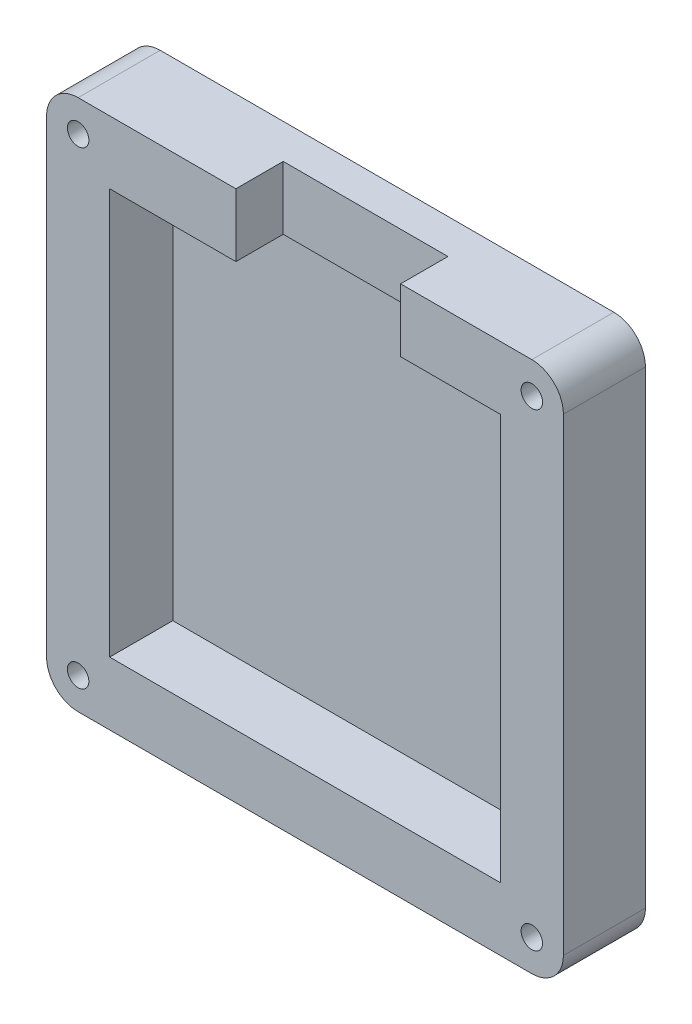
from build123d import *

# Parameters (mm, degrees)
BOSS_EXTRUDE4_START   = 3.1
SKETCH2_R             = 3
SKETCH2_R_2           = 1.7
BOSS_EXTRUDE4_DEPTH   = 9.9
BOSS_EXTRUDE4_2_DEPTH = 9.9
BOSS_EXTRUDE4_3_DEPTH = 9.9
BOSS_EXTRUDE4_4_DEPTH = 9.9
SKETCH2_12_W          = 81.893
SKETCH2_12_H          = 84.275
SKETCH2_12_R          = 3
SKETCH2_12_W_2        = 61.893
SKETCH2_12_H_2        = 64.275
BOSS_EXTRUDE5_DEPTH   = 13
SKETCH2_13_W          = 61.893
SKETCH2_13_H          = 64.275
BOSS_EXTRUDE6_DEPTH   = 3
SKETCH5_W             = 26.09775054
SKETCH5_H             = 10
CUT_EXTRUDE1_DEPTH    = 7.5
FILLET1_R             = 5
SKETCH7_W             = 0.189957265
SKETCH7_H             = 1.546794872
CUT_EXTRUDE2_DEPTH    = 0.2


with BuildPart() as part:
    # Sketch2 → Boss-Extrude4 (new body)
    with BuildSketch(Plane.XY.offset(BOSS_EXTRUDE4_START)):
        with Locations((-35.9465, 37.1375)):
            Circle(SKETCH2_R)
        with Locations((-35.9465, 37.1375)):
            Circle(SKETCH2_R_2, mode=Mode.SUBTRACT)
    extrude(amount=BOSS_EXTRUDE4_DEPTH)



with BuildPart() as body_2:
    # Sketch2 → Boss-Extrude4 2 (new body)
    with BuildSketch(Plane.XY.offset(BOSS_EXTRUDE4_START)):
        with Locations((35.9465, 37.1375)):
            Circle(SKETCH2_R)
        with Locations((35.9465, 37.1375)):
            Circle(SKETCH2_R_2, mode=Mode.SUBTRACT)
    extrude(amount=BOSS_EXTRUDE4_2_DEPTH)


with BuildPart() as body_3:
    # Sketch2 → Boss-Extrude4 3 (new body)
    with BuildSketch(Plane.XY.offset(BOSS_EXTRUDE4_START)):
        with Locations((-35.9465, -37.1375)):
            Circle(SKETCH2_R)
        with Locations((-35.9465, -37.1375)):
            Circle(SKETCH2_R_2, mode=Mode.SUBTRACT)
    extrude(amount=BOSS_EXTRUDE4_3_DEPTH)


with BuildPart() as body_4:
    # Sketch2 → Boss-Extrude4 4 (new body)
    with BuildSketch(Plane.XY.offset(BOSS_EXTRUDE4_START)):
        with Locations((35.9465, -37.1375)):
            Circle(SKETCH2_R)
        with Locations((35.9465, -37.1375)):
            Circle(SKETCH2_R_2, mode=Mode.SUBTRACT)
    extrude(amount=BOSS_EXTRUDE4_4_DEPTH)


with BuildPart() as part_1:
    add(part.part)

    add(body_2.part)  # Boss-Extrude5 merges body 2

    add(body_3.part)  # Boss-Extrude5 merges body 3

    add(body_4.part)  # Boss-Extrude5 merges body 4
    # Sketch2<12> → Boss-Extrude5 (add)
    with BuildSketch(Plane.XY):
        Rectangle(SKETCH2_12_W, SKETCH2_12_H)
        with Locations((-35.9465, -37.1375)):
            Circle(SKETCH2_12_R, mode=Mode.SUBTRACT)
        with Locations((35.9465, -37.1375)):
            Circle(SKETCH2_12_R, mode=Mode.SUBTRACT)
        Rectangle(SKETCH2_12_W_2, SKETCH2_12_H_2, mode=Mode.SUBTRACT)
        with Locations((-35.9465, 37.1375)):
            Circle(SKETCH2_12_R, mode=Mode.SUBTRACT)
        with Locations((35.9465, 37.1375)):
            Circle(SKETCH2_12_R, mode=Mode.SUBTRACT)
    extrude(amount=BOSS_EXTRUDE5_DEPTH)

    # Sketch2<13> → Boss-Extrude6 (add)
    with BuildSketch(Plane.XY):
        Rectangle(SKETCH2_13_W, SKETCH2_13_H)
    extrude(amount=BOSS_EXTRUDE6_DEPTH)

    # Sketch5 → Cut-Extrude1 (cut)
    with BuildSketch(Plane.XY.offset(13)):
        with Locations((2.10237527, 37.1375)):
            Rectangle(SKETCH5_W, SKETCH5_H)
    extrude(amount=-CUT_EXTRUDE1_DEPTH, mode=Mode.SUBTRACT)

    # Fillet1
    fillet1_edges = [part_1.edges().sort_by_distance(p)[0] for p in [
        (-40.9465, -42.1375, 6.5),
        (-40.9465, 42.1375, 6.5),
        (40.9465, -42.1375, 6.5),
        (40.9465, 42.1375, 6.5),
    ]]
    fillet(fillet1_edges, radius=FILLET1_R)

    # Sketch7 → Cut-Extrude2 (cut)
    # profile 1 of 15: a face of its own
    with BuildSketch(Plane(origin=(0, 0, 0), x_dir=(-1, 0, 0), z_dir=(0, 0, -1))):
        with BuildLine():
            Line((0.197612891, 2.170940171), (0.197612891, 0))
            Line((0.197612891, 0), (0.007655626, 0))
            Line((0.007655626, 0), (0.007655626, 0.267551416))
            add(Edge.make_bspline(
                [(0.007655626, 0.267551416), (-0.013764309, 0.243336994), (-0.055565582, 0.196082247), (-0.125379973, 0.134346838), (-0.199383585, 0.083318044), (-0.277217241, 0.042103571), (-0.358810655, 0.011144565), (-0.443982955, -0.010860398), (-0.532768886, -0.025008098), (-0.593397691, -0.026420835), (-0.624121885, -0.027136752)],
                knots=[0, 0, 0, 0, 1.074387032, 2.096679803, 3.090159297, 4.057316773, 5.018401886, 5.985159533, 6.978961417, 8, 8, 8, 8], degree=3))
            add(Edge.make_bspline(
                [(-0.624121885, -0.027136752), (-0.651437743, -0.026395089), (-0.705305824, -0.024932496), (-0.784547218, -0.01358577), (-0.860803007, 0.004636082), (-0.934145248, 0.029976144), (-1.004099355, 0.063589308), (-1.071264271, 0.10383092), (-1.135292042, 0.151752755), (-1.195206734, 0.206536944), (-1.250380373, 0.266042483), (-1.298798381, 0.329509552), (-1.3391681, 0.396663707), (-1.372925959, 0.46665471), (-1.39892851, 0.540021352), (-1.417055422, 0.616509925), (-1.42838893, 0.696029991), (-1.429850918, 0.750180084), (-1.430592237, 0.777637553)],
                knots=[0, 0, 0, 0, 1.033919861, 2.038935746, 3.024066025, 3.998881131, 4.97069526, 5.957263378, 6.95902576, 7.993208707, 9.027059324, 10.027763471, 11.009749337, 11.988697705, 12.965288445, 13.950418724, 14.960734635, 16, 16, 16, 16], degree=3))
            add(Edge.make_bspline(
                [(-1.430592237, 0.777637553), (-1.429834488, 0.804527507), (-1.428336458, 0.857687496), (-1.417176654, 0.935870328), (-1.398410282, 1.011174228), (-1.372074203, 1.083356761), (-1.338303116, 1.152505267), (-1.297222796, 1.218668654), (-1.248830278, 1.282029194), (-1.193039537, 1.341097031), (-1.132602795, 1.395659022), (-1.067948467, 1.443077825), (-1.000684864, 1.484030396), (-0.929768662, 1.516477974), (-0.856249508, 1.542730147), (-0.7794729, 1.560892942), (-0.699758279, 1.571595608), (-0.645637839, 1.57314547), (-0.61818572, 1.573931624)],
                knots=[0, 0, 0, 0, 1.020392517, 2.01726096, 2.990465484, 3.961182959, 4.928053699, 5.906110375, 6.912531644, 7.948652711, 8.985773172, 9.998621852, 10.987621588, 11.969261332, 12.953316658, 13.946091881, 14.958173133, 16, 16, 16, 16], degree=3))
            add(Edge.make_bspline(
                [(-0.61818572, 1.573931624), (-0.586606984, 1.572983904), (-0.524621435, 1.571123635), (-0.433968519, 1.555577403), (-0.348220774, 1.529474139), (-0.266884538, 1.493737983), (-0.190444714, 1.447291815), (-0.118340984, 1.391199273), (-0.05182726, 1.323872856), (-0.0124743, 1.273307761), (0.007655626, 1.247442575)],
                knots=[0, 0, 0, 0, 1.031072012, 2.023879775, 2.993683497, 3.952812103, 4.918022106, 5.908088563, 6.929940113, 8, 8, 8, 8], degree=3))
            Line((0.007655626, 1.247442575), (0.007655626, 2.170940171))
            Line((0.007655626, 2.170940171), (0.197612891, 2.170940171))
        make_face()
        with BuildLine():
            add(Edge.make_bspline(
                [(-0.61564165, 1.383974359), (-0.643408892, 1.382986397), (-0.698217012, 1.381036318), (-0.778676956, 1.365812347), (-0.855671259, 1.34048214), (-0.928814837, 1.305840228), (-0.996952283, 1.262279992), (-1.057847979, 1.209592298), (-1.111999993, 1.149214675), (-1.157543563, 1.08141959), (-1.194670197, 1.008740458), (-1.220775973, 0.932767584), (-1.237993089, 0.85487124), (-1.239752052, 0.802037616), (-1.240634972, 0.775517495)],
                knots=[0, 0, 0, 0, 1.031046209, 2.035121221, 3.029706178, 4.034933723, 5.034054252, 6.02443088, 7.017295772, 8.038157696, 9.050218397, 10.03989886, 11.016116709, 12, 12, 12, 12], degree=3))
            add(Edge.make_bspline(
                [(-1.240634972, 0.775517495), (-1.239507156, 0.749155858), (-1.237255944, 0.696535915), (-1.221078143, 0.618533375), (-1.193936505, 0.542542598), (-1.156899639, 0.469208568), (-1.110522489, 0.401121993), (-1.056766018, 0.339593443), (-0.995110372, 0.286683073), (-0.926816118, 0.242391778), (-0.853877012, 0.206612539), (-0.777172682, 0.181717129), (-0.698145034, 0.1656439), (-0.644410528, 0.16376643), (-0.617337697, 0.162820513)],
                knots=[0, 0, 0, 0, 0.979072187, 1.954306742, 2.945804271, 3.96968567, 4.997920485, 5.998718438, 6.996577872, 8.005894225, 9.015743152, 10.005417472, 10.995077863, 12, 12, 12, 12], degree=3))
            add(Edge.make_bspline(
                [(-0.617337697, 0.162820513), (-0.589853383, 0.163824396), (-0.535189809, 0.165821019), (-0.454491162, 0.181110166), (-0.376177542, 0.206370344), (-0.301315742, 0.24138553), (-0.231576939, 0.284781645), (-0.168985365, 0.335585933), (-0.116059041, 0.394673097), (-0.071190178, 0.459610285), (-0.036007902, 0.530798017), (-0.010380475, 0.60659536), (0.004771172, 0.687004956), (0.006680847, 0.741955997), (0.007655626, 0.770005342)],
                knots=[0, 0, 0, 0, 1.01762866, 2.023962475, 3.030623092, 4.058876274, 5.077231937, 6.066672613, 7.034107872, 8.005628644, 8.981990164, 9.965428785, 10.961468474, 12, 12, 12, 12], degree=3))
            add(Edge.make_bspline(
                [(0.007655626, 0.770005342), (0.007075262, 0.791376316), (0.005932923, 0.833441155), (-0.002794136, 0.895203987), (-0.016676401, 0.954309621), (-0.036238132, 1.0108202), (-0.061935242, 1.064423281), (-0.092927939, 1.115503745), (-0.129761234, 1.163795925), (-0.171842198, 1.20863483), (-0.217904011, 1.249532738), (-0.266644519, 1.286038731), (-0.31864119, 1.316028132), (-0.373019588, 1.34084833), (-0.429874062, 1.360599339), (-0.489667247, 1.373775706), (-0.551763586, 1.382823139), (-0.594124772, 1.383586579), (-0.61564165, 1.383974359)],
                knots=[0, 0, 0, 0, 1.050140795, 2.067009409, 3.05949893, 4.030605086, 5.00011959, 5.97591094, 6.962425594, 7.979863591, 8.993523472, 9.986985069, 10.967611495, 11.937549037, 12.921786183, 13.919465291, 14.943216303, 16, 16, 16, 16], degree=3))
        make_face(mode=Mode.SUBTRACT)
    # profile 2 of 15: a face of its own
    with BuildSketch(Plane(origin=(0, 0, 0), x_dir=(-1, 0, 0), z_dir=(0, 0, -1))):
        with BuildLine():
            Line((2.205732549, 1.546794872), (2.205732549, 0))
            Line((2.205732549, 0), (2.015775284, 0))
            Line((2.015775284, 0), (2.015775284, 0.267551416))
            add(Edge.make_bspline(
                [(2.015775284, 0.267551416), (1.994355349, 0.243336994), (1.952554076, 0.196082247), (1.882739685, 0.134346838), (1.808736073, 0.083318044), (1.730902417, 0.042103571), (1.649309003, 0.011144565), (1.564136703, -0.010860398), (1.475350772, -0.025008098), (1.414721967, -0.026420835), (1.383997773, -0.027136752)],
                knots=[0, 0, 0, 0, 1.074387032, 2.096679803, 3.090159297, 4.057316773, 5.018401886, 5.985159533, 6.978961417, 8, 8, 8, 8], degree=3))
            add(Edge.make_bspline(
                [(1.383997773, -0.027136752), (1.356681916, -0.026395089), (1.302813835, -0.024932496), (1.22357244, -0.01358577), (1.147316651, 0.004636082), (1.07397441, 0.029976144), (1.004020303, 0.063589308), (0.936855387, 0.10383092), (0.872827616, 0.151752755), (0.812912924, 0.206536944), (0.757739285, 0.266042483), (0.709321278, 0.329509552), (0.668951558, 0.396663707), (0.6351937, 0.46665471), (0.609191148, 0.540021352), (0.591064236, 0.616509925), (0.579730728, 0.696029991), (0.57826874, 0.750180084), (0.577527421, 0.777637553)],
                knots=[0, 0, 0, 0, 1.033919861, 2.038935746, 3.024066025, 3.998881131, 4.97069526, 5.957263378, 6.95902576, 7.993208707, 9.027059324, 10.027763471, 11.009749337, 11.988697705, 12.965288445, 13.950418724, 14.960734635, 16, 16, 16, 16], degree=3))
            add(Edge.make_bspline(
                [(0.577527421, 0.777637553), (0.57828517, 0.804527507), (0.5797832, 0.857687496), (0.590943004, 0.935870328), (0.609709376, 1.011174228), (0.636045455, 1.083356761), (0.669816542, 1.152505267), (0.710896862, 1.218668654), (0.75928938, 1.282029194), (0.815080121, 1.341097031), (0.875516863, 1.395659022), (0.940171191, 1.443077825), (1.007434795, 1.484030396), (1.078350996, 1.516477974), (1.15187015, 1.542730147), (1.228646758, 1.560892942), (1.308361379, 1.571595608), (1.362481819, 1.57314547), (1.389933938, 1.573931624)],
                knots=[0, 0, 0, 0, 1.020392517, 2.01726096, 2.990465484, 3.961182959, 4.928053699, 5.906110375, 6.912531644, 7.948652711, 8.985773172, 9.998621852, 10.987621588, 11.969261332, 12.953316658, 13.946091881, 14.958173133, 16, 16, 16, 16], degree=3))
            add(Edge.make_bspline(
                [(1.389933938, 1.573931624), (1.421502424, 1.573062127), (1.483406736, 1.571357083), (1.573956532, 1.55716772), (1.659617716, 1.533195885), (1.741051538, 1.500588636), (1.817965572, 1.457258214), (1.889631663, 1.402599857), (1.956799836, 1.336958282), (1.995734584, 1.286539013), (2.015775284, 1.260586939)],
                knots=[0, 0, 0, 0, 1.038897134, 2.037228247, 3.008116434, 3.962042015, 4.918381754, 5.904844433, 6.921570401, 8, 8, 8, 8], degree=3))
            Line((2.015775284, 1.260586939), (2.015775284, 1.546794872))
            Line((2.015775284, 1.546794872), (2.205732549, 1.546794872))
        make_face()
        with BuildLine():
            add(Edge.make_bspline(
                [(1.392478008, 1.383974359), (1.364710766, 1.382986397), (1.309902646, 1.381036318), (1.229442702, 1.365812347), (1.152448399, 1.34048214), (1.079304821, 1.305840228), (1.011167376, 1.262279992), (0.950271679, 1.209592298), (0.896119665, 1.149214675), (0.850576095, 1.08141959), (0.813449462, 1.008740458), (0.787343685, 0.932767584), (0.770126569, 0.85487124), (0.768367606, 0.802037616), (0.767484686, 0.775517495)],
                knots=[0, 0, 0, 0, 1.031046209, 2.035121221, 3.029706178, 4.034933723, 5.034054252, 6.02443088, 7.017295772, 8.038157696, 9.050218397, 10.03989886, 11.016116709, 12, 12, 12, 12], degree=3))
            add(Edge.make_bspline(
                [(0.767484686, 0.775517495), (0.768612502, 0.749155858), (0.770863714, 0.696535915), (0.787041515, 0.618533375), (0.814183153, 0.542542598), (0.85122002, 0.469208568), (0.897597169, 0.401121993), (0.95135364, 0.339593443), (1.013009286, 0.286683073), (1.08130354, 0.242391778), (1.154242646, 0.206612539), (1.230946976, 0.181717129), (1.309974624, 0.1656439), (1.363709131, 0.16376643), (1.390781961, 0.162820513)],
                knots=[0, 0, 0, 0, 0.979072187, 1.954306742, 2.945804271, 3.96968567, 4.997920485, 5.998718438, 6.996577872, 8.005894225, 9.015743152, 10.005417472, 10.995077863, 12, 12, 12, 12], degree=3))
            add(Edge.make_bspline(
                [(1.390781961, 0.162820513), (1.418266275, 0.163824396), (1.472929849, 0.165821019), (1.553628496, 0.181110166), (1.631942116, 0.206370344), (1.706803916, 0.24138553), (1.776542719, 0.284781645), (1.839134293, 0.335585933), (1.892060617, 0.394673097), (1.936929481, 0.459610285), (1.972111756, 0.530798017), (1.997739183, 0.60659536), (2.01289083, 0.687004956), (2.014800505, 0.741955997), (2.015775284, 0.770005342)],
                knots=[0, 0, 0, 0, 1.01762866, 2.023962475, 3.030623092, 4.058876274, 5.077231937, 6.066672613, 7.034107872, 8.005628644, 8.981990164, 9.965428785, 10.961468474, 12, 12, 12, 12], degree=3))
            add(Edge.make_bspline(
                [(2.015775284, 0.770005342), (2.01519492, 0.791376316), (2.014052581, 0.833441155), (2.005325522, 0.895203987), (1.991443257, 0.954309621), (1.971881526, 1.0108202), (1.946184416, 1.064423281), (1.915191719, 1.115503745), (1.878358424, 1.163795925), (1.83627746, 1.20863483), (1.790215647, 1.249532738), (1.741475139, 1.286038731), (1.689478468, 1.316028132), (1.63510007, 1.34084833), (1.578245596, 1.360599339), (1.518452412, 1.373775706), (1.456356072, 1.382823139), (1.413994886, 1.383586579), (1.392478008, 1.383974359)],
                knots=[0, 0, 0, 0, 1.050140795, 2.067009409, 3.05949893, 4.030605086, 5.00011959, 5.97591094, 6.962425594, 7.979863591, 8.993523472, 9.986985069, 10.967611495, 11.937549037, 12.921786183, 13.919465291, 14.943216303, 16, 16, 16, 16], degree=3))
        make_face(mode=Mode.SUBTRACT)
    # profile 3 of 15: a face of its own
    with BuildSketch(Plane(origin=(0, 0, 0), x_dir=(-1, 0, 0), z_dir=(0, 0, -1))):
        with BuildLine():
            Line((2.585647079, 1.546794872), (2.775604344, 1.546794872))
            Line((2.775604344, 1.546794872), (2.775604344, 1.319100561))
            add(Edge.make_bspline(
                [(2.775604344, 1.319100561), (2.789628022, 1.34030099), (2.816448197, 1.380846647), (2.861026968, 1.434470462), (2.906688507, 1.478869086), (2.953651406, 1.514249785), (3.002261019, 1.540746291), (3.051450508, 1.560154936), (3.101993769, 1.571631693), (3.135958361, 1.573163953), (3.152974803, 1.573931624)],
                knots=[0, 0, 0, 0, 1.2804753, 2.448899062, 3.506932113, 4.484331642, 5.4025378, 6.288909075, 7.142734305, 8, 8, 8, 8], degree=3))
            add(Edge.make_bspline(
                [(3.152974803, 1.573931624), (3.166174534, 1.573211639), (3.193333838, 1.571730223), (3.234447118, 1.561321772), (3.27680673, 1.54470411), (3.304107126, 1.529076928), (3.318339387, 1.520930155)],
                knots=[0, 0, 0, 0, 0.901110191, 1.854092781, 2.881294221, 4, 4, 4, 4], degree=3))
            Line((3.318339387, 1.520930155), (3.214032496, 1.356413595))
            add(Edge.make_bspline(
                [(3.214032496, 1.356413595), (3.204895135, 1.360489851), (3.187550676, 1.368227366), (3.162178153, 1.377384677), (3.138785154, 1.382776683), (3.123881668, 1.383593545), (3.116933804, 1.383974359)],
                knots=[0, 0, 0, 0, 1.180555205, 2.24091978, 3.179933427, 4, 4, 4, 4], degree=3))
            add(Edge.make_bspline(
                [(3.116933804, 1.383974359), (3.101690337, 1.382958336), (3.070598082, 1.380885945), (3.024947932, 1.36459438), (2.980650813, 1.338271973), (2.945470808, 1.309079443), (2.918230969, 1.280929109), (2.898793785, 1.256346503), (2.880963743, 1.228782283), (2.863927467, 1.198707665), (2.84840547, 1.165609139), (2.833918598, 1.129817386), (2.820820143, 1.091290951), (2.813351186, 1.064450094), (2.809525284, 1.050701122)],
                knots=[0, 0, 0, 0, 1.125678352, 2.296057538, 3.5422874, 4.923748041, 5.663163013, 6.437101912, 7.23742474, 8.08941207, 8.991984279, 9.93940061, 10.944477711, 12, 12, 12, 12], degree=3))
            add(Edge.make_bspline(
                [(2.809525284, 1.050701122), (2.806663313, 1.03843826), (2.800324264, 1.011276952), (2.79416081, 0.965709035), (2.788071149, 0.911870917), (2.783779385, 0.84961274), (2.779801236, 0.779089976), (2.777557519, 0.70019519), (2.775680858, 0.612847401), (2.775630622, 0.551781959), (2.775604344, 0.519838408)],
                knots=[0, 0, 0, 0, 0.566838948, 1.255505196, 2.06880316, 3.007127437, 4.065329342, 5.249902469, 6.561414163, 8, 8, 8, 8], degree=3))
            Line((2.775604344, 0.519838408), (2.775604344, 0))
            Line((2.775604344, 0), (2.585647079, 0))
            Line((2.585647079, 0), (2.585647079, 1.546794872))
        make_face()
    # profile 4 of 15: a face of its own
    with BuildSketch(Plane(origin=(0, 0, 0), x_dir=(-1, 0, 0), z_dir=(0, 0, -1))):
        with BuildLine():
            Line((4.240988959, 1.353869525), (4.112089387, 1.221153846))
            add(Edge.make_bspline(
                [(4.112089387, 1.221153846), (4.100967511, 1.234043225), (4.079525843, 1.25889243), (4.045519186, 1.292116275), (4.011638244, 1.320018138), (3.978346819, 1.343574981), (3.944807771, 1.361384703), (3.911414682, 1.374383976), (3.878132978, 1.382428402), (3.855886186, 1.383465229), (3.844961983, 1.383974359)],
                knots=[0, 0, 0, 0, 1.26578478, 2.440284043, 3.530471711, 4.527705817, 5.468200915, 6.346673037, 7.188140097, 8, 8, 8, 8], degree=3))
            add(Edge.make_bspline(
                [(3.844961983, 1.383974359), (3.831572923, 1.383324317), (3.805225149, 1.382045126), (3.767472392, 1.369276527), (3.732426062, 1.349676957), (3.702093031, 1.321876909), (3.676398101, 1.289967089), (3.657642208, 1.254288359), (3.646172303, 1.215917399), (3.644718013, 1.189289819), (3.643980412, 1.175784589)],
                knots=[0, 0, 0, 0, 0.99966794, 1.967205029, 2.953328237, 3.988086729, 5.028030931, 6.008226631, 6.989793394, 8, 8, 8, 8], degree=3))
            add(Edge.make_bspline(
                [(3.643980412, 1.175784589), (3.644652189, 1.163561114), (3.645993849, 1.139148624), (3.656423984, 1.103136241), (3.673034418, 1.068025556), (3.688558774, 1.046518465), (3.69655787, 1.035436699)],
                knots=[0, 0, 0, 0, 0.960159726, 1.917612774, 2.927026955, 4, 4, 4, 4], degree=3))
            add(Edge.make_bspline(
                [(3.69655787, 1.035436699), (3.701373887, 1.029519355), (3.711624174, 1.016925034), (3.730860752, 0.999445085), (3.752645789, 0.980127628), (3.778844037, 0.960813446), (3.808326802, 0.94047426), (3.841733417, 0.919911065), (3.878003712, 0.897556389), (3.90397056, 0.883378087), (3.917467992, 0.87600828)],
                knots=[0, 0, 0, 0, 0.66740084, 1.420478572, 2.27185888, 3.217733974, 4.268547843, 5.408967954, 6.65319498, 8, 8, 8, 8], degree=3))
            add(Edge.make_bspline(
                [(3.917467992, 0.87600828), (3.933925727, 0.866788743), (3.965716651, 0.848979635), (4.010887992, 0.821336147), (4.051883012, 0.793860953), (4.089049058, 0.766847887), (4.121671009, 0.739541153), (4.15073862, 0.712987414), (4.175526869, 0.686384356), (4.18940853, 0.66779814), (4.196043714, 0.658914263)],
                knots=[0, 0, 0, 0, 1.27191281, 2.456916733, 3.569705269, 4.599008579, 5.553216877, 6.436649441, 7.252746552, 8, 8, 8, 8], degree=3))
            add(Edge.make_bspline(
                [(4.196043714, 0.658914263), (4.207056747, 0.640973343), (4.228974727, 0.605267583), (4.251990917, 0.546473581), (4.26533213, 0.484116277), (4.267184045, 0.441461078), (4.268125711, 0.419771635)],
                knots=[0, 0, 0, 0, 0.995354457, 1.980940102, 2.973342416, 4, 4, 4, 4], degree=3))
            add(Edge.make_bspline(
                [(4.268125711, 0.419771635), (4.267690565, 0.404489818), (4.266833061, 0.374375328), (4.260871277, 0.330025216), (4.250617554, 0.287610508), (4.236651331, 0.246670979), (4.21779221, 0.207991048), (4.195689495, 0.170594841), (4.16915562, 0.135291302), (4.138862264, 0.102126788), (4.105693799, 0.071836836), (4.070311515, 0.045212825), (4.032671841, 0.02309406), (3.993043728, 0.004790732), (3.951337137, -0.009764834), (3.907545548, -0.019841698), (3.861808158, -0.025872844), (3.830705369, -0.026710122), (3.814857148, -0.027136752)],
                knots=[0, 0, 0, 0, 1.032770009, 2.035186124, 3.017557409, 3.978232242, 4.952395191, 5.920591857, 6.910227898, 7.931268572, 8.952309245, 9.941945286, 10.918353717, 11.897095711, 12.887975737, 13.898235213, 14.929059601, 16, 16, 16, 16], degree=3))
            add(Edge.make_bspline(
                [(3.814857148, -0.027136752), (3.793468428, -0.026536405), (3.750988182, -0.025344052), (3.688159637, -0.014152291), (3.62676375, 0.003262066), (3.567265133, 0.02728075), (3.510994388, 0.057609991), (3.459510447, 0.093933438), (3.412634468, 0.135051199), (3.385953417, 0.166567102), (3.372612891, 0.182325053)],
                knots=[0, 0, 0, 0, 1.013940152, 2.01379169, 3.017749504, 4.037548394, 5.051665909, 6.043208538, 7.021604269, 8, 8, 8, 8], degree=3))
            Line((3.372612891, 0.182325053), (3.498544381, 0.325641026))
            add(Edge.make_bspline(
                [(3.498544381, 0.325641026), (3.510501983, 0.312726478), (3.533683603, 0.287689673), (3.570756244, 0.254352572), (3.608480929, 0.226411803), (3.646480954, 0.203041738), (3.685318821, 0.185034709), (3.724776882, 0.17238394), (3.764774882, 0.164253405), (3.791639697, 0.16329892), (3.805104878, 0.162820513)],
                knots=[0, 0, 0, 0, 1.179806542, 2.287233372, 3.337373186, 4.324005949, 5.273901747, 6.200048787, 7.097828587, 8, 8, 8, 8], degree=3))
            add(Edge.make_bspline(
                [(3.805104878, 0.162820513), (3.823440005, 0.163649535), (3.859263767, 0.165269307), (3.91057404, 0.179975358), (3.957950257, 0.2030349), (3.999088185, 0.235743265), (4.034105206, 0.273816397), (4.059461768, 0.316702555), (4.075352598, 0.363143102), (4.077218893, 0.395335971), (4.078168446, 0.411715411)],
                knots=[0, 0, 0, 0, 1.072336372, 2.095165389, 3.102688358, 4.141489647, 5.156069229, 6.117746104, 7.042326257, 8, 8, 8, 8], degree=3))
            add(Edge.make_bspline(
                [(4.078168446, 0.411715411), (4.077511497, 0.425207419), (4.076214438, 0.451845582), (4.066028269, 0.490399359), (4.04993383, 0.526968877), (4.034086257, 0.548371187), (4.026015001, 0.559271501)],
                knots=[0, 0, 0, 0, 1.013901739, 2.00181326, 2.98231254, 4, 4, 4, 4], degree=3))
            add(Edge.make_bspline(
                [(4.026015001, 0.559271501), (4.021163362, 0.564735744), (4.010594741, 0.576638838), (3.991208953, 0.593829243), (3.967997065, 0.612357998), (3.940698014, 0.631910912), (3.909256768, 0.652230068), (3.873545894, 0.673208867), (3.834054608, 0.69584373), (3.806132369, 0.710853712), (3.791536502, 0.71869992)],
                knots=[0, 0, 0, 0, 0.615000592, 1.339693406, 2.178160186, 3.116406724, 4.166410947, 5.330106347, 6.604359322, 8, 8, 8, 8], degree=3))
            add(Edge.make_bspline(
                [(3.791536502, 0.71869992), (3.775784486, 0.727492633), (3.745236301, 0.744544509), (3.701967225, 0.771103282), (3.662931444, 0.798116348), (3.627189668, 0.824068398), (3.595644679, 0.850327731), (3.568420748, 0.876923497), (3.544446042, 0.902783108), (3.531173083, 0.921105759), (3.52483311, 0.929857772)],
                knots=[0, 0, 0, 0, 1.262093308, 2.447601706, 3.550203992, 4.582594899, 5.537233252, 6.418365656, 7.244515135, 8, 8, 8, 8], degree=3))
            add(Edge.make_bspline(
                [(3.52483311, 0.929857772), (3.513868414, 0.94748393), (3.49193519, 0.982742405), (3.470638384, 1.041592074), (3.4559995, 1.103546942), (3.454691769, 1.146295659), (3.454023147, 1.168152377)],
                knots=[0, 0, 0, 0, 0.985009483, 1.970363186, 2.962279964, 4, 4, 4, 4], degree=3))
            add(Edge.make_bspline(
                [(3.454023147, 1.168152377), (3.454346208, 1.182440118), (3.454978484, 1.210403251), (3.460024649, 1.251490061), (3.469212017, 1.290526325), (3.480735708, 1.328098285), (3.496751621, 1.363478123), (3.515889858, 1.397137641), (3.538379396, 1.429030316), (3.564289387, 1.458665543), (3.592777691, 1.485583088), (3.623556909, 1.50904702), (3.655934807, 1.529068482), (3.69004847, 1.545859794), (3.726225613, 1.55856063), (3.764213361, 1.567303906), (3.803934822, 1.573143005), (3.831089312, 1.573664965), (3.844961983, 1.573931624)],
                knots=[0, 0, 0, 0, 1.087655834, 2.128696564, 3.144119009, 4.137814668, 5.115653402, 6.093965665, 7.082169637, 8.081268856, 9.086088321, 10.061021666, 11.022561449, 11.980240094, 12.950172527, 13.934149372, 14.944599409, 16, 16, 16, 16], degree=3))
            add(Edge.make_bspline(
                [(3.844961983, 1.573931624), (3.861406707, 1.573263761), (3.894604641, 1.571915506), (3.944409582, 1.561207779), (3.994141174, 1.543589187), (4.0439272, 1.519255846), (4.093402947, 1.487767783), (4.143003617, 1.44971054), (4.193324664, 1.405334494), (4.224745863, 1.371407819), (4.240988959, 1.353869525)],
                knots=[0, 0, 0, 0, 0.845714091, 1.707292901, 2.609013841, 3.555613372, 4.552488639, 5.621697636, 6.770543573, 8, 8, 8, 8], degree=3))
        make_face()
    # profile 5 of 15: a face of its own
    with BuildSketch(Plane(origin=(0, 0, 0), x_dir=(-1, 0, 0), z_dir=(0, 0, -1))):
        with BuildLine():
            Line((4.648040241, 2.170940171), (4.837997506, 2.170940171))
            Line((4.837997506, 2.170940171), (4.837997506, 1.254650775))
            add(Edge.make_bspline(
                [(4.837997506, 1.254650775), (4.858388446, 1.280137849), (4.89809065, 1.32976249), (4.964914492, 1.39450902), (5.033537353, 1.450630091), (5.106329404, 1.495304129), (5.181955195, 1.530595944), (5.260733685, 1.555625615), (5.342679511, 1.571017469), (5.398332816, 1.57295175), (5.426525818, 1.573931624)],
                knots=[0, 0, 0, 0, 1.125788106, 2.19196713, 3.20547328, 4.180437432, 5.132270164, 6.079753143, 7.027236121, 8, 8, 8, 8], degree=3))
            add(Edge.make_bspline(
                [(5.426525818, 1.573931624), (5.455149437, 1.572876054), (5.511172763, 1.57081005), (5.592743933, 1.554473386), (5.668920272, 1.526559126), (5.739475329, 1.488358115), (5.802869312, 1.440779786), (5.859021313, 1.385848342), (5.904886939, 1.322182687), (5.936092119, 1.263365809), (5.956396037, 1.211030467), (5.969248332, 1.166135053), (5.980145657, 1.116107991), (5.989640259, 1.060975034), (5.995968234, 1.000471526), (6.001051027, 0.934870429), (6.004665359, 0.864175505), (6.004805424, 0.815238021), (6.004877848, 0.789933894)],
                knots=[0, 0, 0, 0, 1.235656852, 2.418478516, 3.575258207, 4.727955599, 5.870717718, 6.98870536, 8.107142894, 9.245821548, 9.854588956, 10.528768408, 11.260415777, 12.065282286, 12.943670737, 13.886611085, 14.907229059, 16, 16, 16, 16], degree=3))
            Line((6.004877848, 0.789933894), (6.004877848, 0))
            Line((6.004877848, 0), (5.814920583, 0))
            Line((5.814920583, 0), (5.814920583, 0.727604167))
            add(Edge.make_bspline(
                [(5.814920583, 0.727604167), (5.814805495, 0.748663591), (5.814585351, 0.788946685), (5.813857614, 0.846620474), (5.812233093, 0.898930041), (5.809607927, 0.94570774), (5.806847003, 0.987018786), (5.803047093, 1.022803186), (5.798626141, 1.053110088), (5.794653593, 1.071352506), (5.792871972, 1.079533921)],
                knots=[0, 0, 0, 0, 1.430932559, 2.737130458, 3.918967929, 4.986496826, 5.920444988, 6.731744033, 7.431208747, 8, 8, 8, 8], degree=3))
            add(Edge.make_bspline(
                [(5.792871972, 1.079533921), (5.785963024, 1.103539499), (5.772680611, 1.149690084), (5.741808739, 1.212381161), (5.703249718, 1.265832885), (5.65617066, 1.309323907), (5.601404411, 1.343439457), (5.538593862, 1.367066163), (5.468330163, 1.381730262), (5.418829511, 1.38320546), (5.39302889, 1.383974359)],
                knots=[0, 0, 0, 0, 1.090059168, 2.095632401, 3.037101401, 3.955032261, 4.878929692, 5.839099886, 6.873700383, 8, 8, 8, 8], degree=3))
            add(Edge.make_bspline(
                [(5.39302889, 1.383974359), (5.377747903, 1.383686597), (5.347507225, 1.383117125), (5.302664937, 1.377399767), (5.25916498, 1.36805697), (5.216588424, 1.355414702), (5.175837633, 1.338211925), (5.135724789, 1.318297001), (5.097386387, 1.293920104), (5.060141631, 1.266569283), (5.02547817, 1.236288999), (4.993227962, 1.204329174), (4.964478585, 1.17029622), (4.938432342, 1.134736149), (4.915948331, 1.097161208), (4.896321943, 1.057933739), (4.879669403, 1.017002156), (4.871394632, 0.988593428), (4.867254317, 0.974379006)],
                knots=[0, 0, 0, 0, 1.024319606, 2.027102035, 3.025350316, 4.005802111, 5.00026367, 5.987881639, 7.005602596, 8.042517216, 9.083927026, 10.089214625, 11.084353441, 12.06828073, 13.041928858, 14.016821737, 15.00770877, 16, 16, 16, 16], degree=3))
            add(Edge.make_bspline(
                [(4.867254317, 0.974379006), (4.864871902, 0.964085384), (4.859680325, 0.941654313), (4.854047069, 0.904658412), (4.849004687, 0.861668082), (4.844741993, 0.812748529), (4.842127555, 0.757720492), (4.839310428, 0.696959483), (4.838261762, 0.630084899), (4.838088224, 0.583581426), (4.837997506, 0.559271501)],
                knots=[0, 0, 0, 0, 0.607992626, 1.324890765, 2.152360218, 3.099583803, 4.150613268, 5.323148443, 6.60066238, 8, 8, 8, 8], degree=3))
            Line((4.837997506, 0.559271501), (4.837997506, 0))
            Line((4.837997506, 0), (4.648040241, 0))
            Line((4.648040241, 0), (4.648040241, 2.170940171))
        make_face()
    # profile 6 of 15: a face of its own
    with BuildSketch(Plane(origin=(0, 0, 0), x_dir=(-1, 0, 0), z_dir=(0, 0, -1))):
        Polygon((6.54506882, 1.51965812), (6.413201165, 1.51965812), (6.384792378, 2.170940171), (6.574749643, 2.170940171), align=None)
    # profile 7 of 15: a face of its own
    with BuildSketch(Plane(origin=(0, 0, 0), x_dir=(-1, 0, 0), z_dir=(0, 0, -1))):
        with BuildLine():
            Line((7.741629985, 1.353869525), (7.612730412, 1.221153846))
            add(Edge.make_bspline(
                [(7.612730412, 1.221153846), (7.601608536, 1.234043225), (7.580166869, 1.25889243), (7.546160211, 1.292116275), (7.51227927, 1.320018138), (7.478987845, 1.343574981), (7.445448796, 1.361384703), (7.412055708, 1.374383976), (7.378774004, 1.382428402), (7.356527211, 1.383465229), (7.345603008, 1.383974359)],
                knots=[0, 0, 0, 0, 1.26578478, 2.440284043, 3.530471711, 4.527705817, 5.468200915, 6.346673037, 7.188140097, 8, 8, 8, 8], degree=3))
            add(Edge.make_bspline(
                [(7.345603008, 1.383974359), (7.332213949, 1.383324317), (7.305866175, 1.382045126), (7.268113418, 1.369276527), (7.233067087, 1.349676957), (7.202734057, 1.321876909), (7.177039126, 1.289967089), (7.158283233, 1.254288359), (7.146813329, 1.215917399), (7.145359039, 1.189289819), (7.144621438, 1.175784589)],
                knots=[0, 0, 0, 0, 0.99966794, 1.967205029, 2.953328237, 3.988086729, 5.028030931, 6.008226631, 6.989793394, 8, 8, 8, 8], degree=3))
            add(Edge.make_bspline(
                [(7.144621438, 1.175784589), (7.145293215, 1.163561114), (7.146634875, 1.139148624), (7.15706501, 1.103136241), (7.173675444, 1.068025556), (7.189199799, 1.046518465), (7.197198895, 1.035436699)],
                knots=[0, 0, 0, 0, 0.960159726, 1.917612774, 2.927026955, 4, 4, 4, 4], degree=3))
            add(Edge.make_bspline(
                [(7.197198895, 1.035436699), (7.202014913, 1.029519355), (7.212265199, 1.016925034), (7.231501778, 0.999445085), (7.253286815, 0.980127628), (7.279485063, 0.960813446), (7.308967828, 0.94047426), (7.342374442, 0.919911065), (7.378644738, 0.897556389), (7.404611585, 0.883378087), (7.418109018, 0.87600828)],
                knots=[0, 0, 0, 0, 0.66740084, 1.420478572, 2.27185888, 3.217733974, 4.268547843, 5.408967954, 6.65319498, 8, 8, 8, 8], degree=3))
            add(Edge.make_bspline(
                [(7.418109018, 0.87600828), (7.434566753, 0.866788743), (7.466357677, 0.848979635), (7.511529017, 0.821336147), (7.552524037, 0.793860953), (7.589690084, 0.766847887), (7.622312035, 0.739541153), (7.651379645, 0.712987414), (7.676167895, 0.686384356), (7.690049555, 0.66779814), (7.696684739, 0.658914263)],
                knots=[0, 0, 0, 0, 1.27191281, 2.456916733, 3.569705269, 4.599008579, 5.553216877, 6.436649441, 7.252746552, 8, 8, 8, 8], degree=3))
            add(Edge.make_bspline(
                [(7.696684739, 0.658914263), (7.707697772, 0.640973343), (7.729615753, 0.605267583), (7.752631942, 0.546473581), (7.765973156, 0.484116277), (7.76782507, 0.441461078), (7.768766737, 0.419771635)],
                knots=[0, 0, 0, 0, 0.995354457, 1.980940102, 2.973342416, 4, 4, 4, 4], degree=3))
            add(Edge.make_bspline(
                [(7.768766737, 0.419771635), (7.76833159, 0.404489818), (7.767474086, 0.374375328), (7.761512303, 0.330025216), (7.751258579, 0.287610508), (7.737292357, 0.246670979), (7.718433236, 0.207991048), (7.696330521, 0.170594841), (7.669796645, 0.135291302), (7.63950329, 0.102126788), (7.606334824, 0.071836836), (7.570952541, 0.045212825), (7.533312867, 0.02309406), (7.493684754, 0.004790732), (7.451978163, -0.009764834), (7.408186573, -0.019841698), (7.362449184, -0.025872844), (7.331346395, -0.026710122), (7.315498174, -0.027136752)],
                knots=[0, 0, 0, 0, 1.032770009, 2.035186124, 3.017557409, 3.978232242, 4.952395191, 5.920591857, 6.910227898, 7.931268572, 8.952309245, 9.941945286, 10.918353717, 11.897095711, 12.887975737, 13.898235213, 14.929059601, 16, 16, 16, 16], degree=3))
            add(Edge.make_bspline(
                [(7.315498174, -0.027136752), (7.294109454, -0.026536405), (7.251629207, -0.025344052), (7.188800663, -0.014152291), (7.127404776, 0.003262066), (7.067906158, 0.02728075), (7.011635413, 0.057609991), (6.960151473, 0.093933438), (6.913275493, 0.135051199), (6.886594442, 0.166567102), (6.873253917, 0.182325053)],
                knots=[0, 0, 0, 0, 1.013940152, 2.01379169, 3.017749504, 4.037548394, 5.051665909, 6.043208538, 7.021604269, 8, 8, 8, 8], degree=3))
            Line((6.873253917, 0.182325053), (6.999185407, 0.325641026))
            add(Edge.make_bspline(
                [(6.999185407, 0.325641026), (7.011143009, 0.312726478), (7.034324629, 0.287689673), (7.071397269, 0.254352572), (7.109121955, 0.226411803), (7.14712198, 0.203041738), (7.185959846, 0.185034709), (7.225417908, 0.17238394), (7.265415907, 0.164253405), (7.292280723, 0.16329892), (7.305745904, 0.162820513)],
                knots=[0, 0, 0, 0, 1.179806542, 2.287233372, 3.337373186, 4.324005949, 5.273901747, 6.200048787, 7.097828587, 8, 8, 8, 8], degree=3))
            add(Edge.make_bspline(
                [(7.305745904, 0.162820513), (7.32408103, 0.163649535), (7.359904792, 0.165269307), (7.411215065, 0.179975358), (7.458591282, 0.2030349), (7.49972921, 0.235743265), (7.534746231, 0.273816397), (7.560102794, 0.316702555), (7.575993624, 0.363143102), (7.577859918, 0.395335971), (7.578809472, 0.411715411)],
                knots=[0, 0, 0, 0, 1.072336372, 2.095165389, 3.102688358, 4.141489647, 5.156069229, 6.117746104, 7.042326257, 8, 8, 8, 8], degree=3))
            add(Edge.make_bspline(
                [(7.578809472, 0.411715411), (7.578152523, 0.425207419), (7.576855464, 0.451845582), (7.566669295, 0.490399359), (7.550574855, 0.526968877), (7.534727282, 0.548371187), (7.526656027, 0.559271501)],
                knots=[0, 0, 0, 0, 1.013901739, 2.00181326, 2.98231254, 4, 4, 4, 4], degree=3))
            add(Edge.make_bspline(
                [(7.526656027, 0.559271501), (7.521804388, 0.564735744), (7.511235767, 0.576638838), (7.491849978, 0.593829243), (7.46863809, 0.612357998), (7.441339039, 0.631910912), (7.409897793, 0.652230068), (7.37418692, 0.673208867), (7.334695634, 0.69584373), (7.306773395, 0.710853712), (7.292177528, 0.71869992)],
                knots=[0, 0, 0, 0, 0.615000592, 1.339693406, 2.178160186, 3.116406724, 4.166410947, 5.330106347, 6.604359322, 8, 8, 8, 8], degree=3))
            add(Edge.make_bspline(
                [(7.292177528, 0.71869992), (7.276425512, 0.727492633), (7.245877327, 0.744544509), (7.202608251, 0.771103282), (7.16357247, 0.798116348), (7.127830694, 0.824068398), (7.096285705, 0.850327731), (7.069061774, 0.876923497), (7.045087067, 0.902783108), (7.031814109, 0.921105759), (7.025474136, 0.929857772)],
                knots=[0, 0, 0, 0, 1.262093308, 2.447601706, 3.550203992, 4.582594899, 5.537233252, 6.418365656, 7.244515135, 8, 8, 8, 8], degree=3))
            add(Edge.make_bspline(
                [(7.025474136, 0.929857772), (7.01450944, 0.94748393), (6.992576216, 0.982742405), (6.97127941, 1.041592074), (6.956640526, 1.103546942), (6.955332794, 1.146295659), (6.954664173, 1.168152377)],
                knots=[0, 0, 0, 0, 0.985009483, 1.970363186, 2.962279964, 4, 4, 4, 4], degree=3))
            add(Edge.make_bspline(
                [(6.954664173, 1.168152377), (6.954987234, 1.182440118), (6.95561951, 1.210403251), (6.960665675, 1.251490061), (6.969853043, 1.290526325), (6.981376734, 1.328098285), (6.997392646, 1.363478123), (7.016530884, 1.397137641), (7.039020422, 1.429030316), (7.064930412, 1.458665543), (7.093418717, 1.485583088), (7.124197935, 1.50904702), (7.156575833, 1.529068482), (7.190689496, 1.545859794), (7.226866639, 1.55856063), (7.264854387, 1.567303906), (7.304575847, 1.573143005), (7.331730338, 1.573664965), (7.345603008, 1.573931624)],
                knots=[0, 0, 0, 0, 1.087655834, 2.128696564, 3.144119009, 4.137814668, 5.115653402, 6.093965665, 7.082169637, 8.081268856, 9.086088321, 10.061021666, 11.022561449, 11.980240094, 12.950172527, 13.934149372, 14.944599409, 16, 16, 16, 16], degree=3))
            add(Edge.make_bspline(
                [(7.345603008, 1.573931624), (7.362047733, 1.573263761), (7.395245667, 1.571915506), (7.445050607, 1.561207779), (7.4947822, 1.543589187), (7.544568226, 1.519255846), (7.594043972, 1.487767783), (7.643644643, 1.44971054), (7.69396569, 1.405334494), (7.725386888, 1.371407819), (7.741629985, 1.353869525)],
                knots=[0, 0, 0, 0, 0.845714091, 1.707292901, 2.609013841, 3.555613372, 4.552488639, 5.621697636, 6.770543573, 8, 8, 8, 8], degree=3))
        make_face()
    # profile 8 of 15: a face of its own
    with BuildSketch(Plane(origin=(0, 0, 0), x_dir=(-1, 0, 0), z_dir=(0, 0, -1))):
        Polygon((9.152741096, 2.170940171), (9.342698361, 2.170940171), (9.342698361, 1.546794872), (9.614065882, 1.546794872), (9.614065882, 1.356837607), (9.342698361, 1.356837607), (9.342698361, 0), (9.152741096, 0), (9.152741096, 1.356837607), (8.881373575, 1.356837607), (8.881373575, 1.546794872), (9.152741096, 1.546794872), align=None)
    # profile 9 of 15: a face of its own
    with BuildSketch(Plane(origin=(0, 0, 0), x_dir=(-1, 0, 0), z_dir=(0, 0, -1))):
        with BuildLine():
            Line((11.209198094, 0.488461538), (11.377954771, 0.399843082))
            add(Edge.make_bspline(
                [(11.377954771, 0.399843082), (11.364506926, 0.375989258), (11.338342743, 0.329579163), (11.293348005, 0.26581799), (11.246181371, 0.208457705), (11.194713733, 0.159030723), (11.140484927, 0.1159406), (11.083194227, 0.078241058), (11.02254337, 0.046117001), (10.958529489, 0.019052377), (10.890614998, -0.001757175), (10.818635319, -0.016455441), (10.742452558, -0.025540942), (10.690233678, -0.026596337), (10.663494969, -0.027136752)],
                knots=[0, 0, 0, 0, 1.120438281, 2.179929193, 3.190490725, 4.156257408, 5.095198341, 6.022838206, 6.959905092, 7.901321166, 8.864066838, 9.862729781, 10.905609505, 12, 12, 12, 12], degree=3))
            add(Edge.make_bspline(
                [(10.663494969, -0.027136752), (10.633775773, -0.026442984), (10.575802231, -0.025089644), (10.491413908, -0.013422296), (10.411960641, 0.005610987), (10.337446896, 0.032199672), (10.268055153, 0.06692953), (10.203647493, 0.109238359), (10.143885209, 0.158908818), (10.09065152, 0.216371143), (10.042727839, 0.277864517), (10.000439367, 0.3419426), (9.965086539, 0.408444169), (9.936328532, 0.476945867), (9.913102733, 0.547015936), (9.89691525, 0.619291919), (9.887583926, 0.693578201), (9.886154, 0.743832304), (9.885433404, 0.769157318)],
                knots=[0, 0, 0, 0, 1.145258523, 2.234067595, 3.276747158, 4.290159414, 5.277019952, 6.260822364, 7.254936242, 8.264827045, 9.274100331, 10.257902744, 11.220704747, 12.172965371, 13.118907548, 14.062713208, 15.023725156, 16, 16, 16, 16], degree=3))
            add(Edge.make_bspline(
                [(9.885433404, 0.769157318), (9.886073932, 0.792921335), (9.887343375, 0.840018477), (9.895344851, 0.909726688), (9.909525485, 0.977477228), (9.9289845, 1.043326394), (9.954113111, 1.107163932), (9.984854501, 1.169028695), (10.021256558, 1.228854851), (10.04936146, 1.266593889), (10.06351834, 1.285603632)],
                knots=[0, 0, 0, 0, 1.024358464, 2.0301432, 3.019427413, 4.004406732, 4.986367066, 5.972626655, 6.978780325, 8, 8, 8, 8], degree=3))
            add(Edge.make_bspline(
                [(10.06351834, 1.285603632), (10.082693938, 1.308505282), (10.120437701, 1.353583116), (10.184274164, 1.412812485), (10.253398568, 1.462429435), (10.326944647, 1.50355756), (10.405767181, 1.534807813), (10.48880661, 1.558095732), (10.577008464, 1.571145291), (10.637306383, 1.572988504), (10.668159098, 1.573931624)],
                knots=[0, 0, 0, 0, 1.030682036, 2.02871468, 2.997146059, 3.962720338, 4.930598197, 5.918074684, 6.934738563, 8, 8, 8, 8], degree=3))
            add(Edge.make_bspline(
                [(10.668159098, 1.573931624), (10.699877412, 1.573112747), (10.762101513, 1.571506296), (10.852835224, 1.556613228), (10.938687658, 1.532995731), (11.019624458, 1.499640819), (11.095653831, 1.456606233), (11.166281585, 1.403301405), (11.232715595, 1.341362848), (11.271365068, 1.293729859), (11.291032362, 1.269491186)],
                knots=[0, 0, 0, 0, 1.056321875, 2.072262726, 3.055038591, 4.01806755, 4.982017516, 5.957941055, 6.960871419, 8, 8, 8, 8], degree=3))
            add(Edge.make_bspline(
                [(11.291032362, 1.269491186), (11.304413891, 1.25122521), (11.331087879, 1.214814843), (11.36449922, 1.155444668), (11.393502026, 1.093329213), (11.41668434, 1.027464414), (11.435455848, 0.958630668), (11.449036877, 0.886335891), (11.45700136, 0.810601611), (11.458566906, 0.758999361), (11.459365028, 0.732692308)],
                knots=[0, 0, 0, 0, 0.94817472, 1.890038105, 2.849395472, 3.817997239, 4.812318967, 5.836947057, 6.897266129, 8, 8, 8, 8], degree=3))
            Line((11.459365028, 0.732692308), (10.075390669, 0.732692308))
            add(Edge.make_bspline(
                [(10.075390669, 0.732692308), (10.076321764, 0.712311551), (10.078152725, 0.672233614), (10.086689026, 0.613589379), (10.100144237, 0.5577255), (10.119054575, 0.505060994), (10.141955, 0.454908012), (10.170007315, 0.40763859), (10.203474569, 0.363468032), (10.24080392, 0.322001239), (10.282355354, 0.285074017), (10.326069206, 0.252022705), (10.372571505, 0.224321225), (10.421495584, 0.201836244), (10.47276233, 0.184233853), (10.526387896, 0.172218552), (10.582266757, 0.16417092), (10.620358129, 0.163276075), (10.639750311, 0.162820513)],
                knots=[0, 0, 0, 0, 1.094153842, 2.151609401, 3.174256925, 4.172055639, 5.149267565, 6.128595816, 7.11444997, 8.118368179, 9.117203808, 10.09244225, 11.054858984, 12.015122123, 12.976791628, 13.957293641, 14.960065497, 16, 16, 16, 16], degree=3))
            add(Edge.make_bspline(
                [(10.639750311, 0.162820513), (10.658710291, 0.163188242), (10.696330527, 0.163917888), (10.752356189, 0.171012901), (10.807473903, 0.182485401), (10.861455545, 0.198142681), (10.913205533, 0.217239158), (10.961130223, 0.240282315), (11.005205401, 0.265772876), (11.046399947, 0.294928251), (11.086357167, 0.330614154), (11.125994766, 0.375146233), (11.168495409, 0.427813452), (11.195098639, 0.467452974), (11.209198094, 0.488461538)],
                knots=[0, 0, 0, 0, 0.99110716, 1.966546729, 2.947904876, 3.932708344, 4.903319531, 5.828989031, 6.710028674, 7.56322171, 8.463672341, 9.504779593, 10.677557249, 12, 12, 12, 12], degree=3))
        make_face()
        with BuildLine():
            add(Edge.make_bspline(
                [(11.269407763, 0.922649573), (11.262455042, 0.947845692), (11.249073293, 0.99634011), (11.221111301, 1.06349341), (11.189620417, 1.123176093), (11.152353942, 1.174931395), (11.110130236, 1.220895424), (11.061359102, 1.261062854), (11.006666919, 1.296996265), (10.946336391, 1.327326586), (10.882448263, 1.353143787), (10.815557852, 1.370455166), (10.747305761, 1.38231427), (10.701141693, 1.383418631), (10.677911368, 1.383974359)],
                knots=[0, 0, 0, 0, 1.154881502, 2.222775134, 3.210006277, 4.132804581, 5.035138423, 5.962687519, 6.919655026, 7.923214229, 8.944639381, 9.960483929, 10.97369054, 12, 12, 12, 12], degree=3))
            add(Edge.make_bspline(
                [(10.677911368, 1.383974359), (10.658952422, 1.383604443), (10.621474572, 1.382873198), (10.566259164, 1.375936501), (10.513233822, 1.364470309), (10.462007291, 1.348767692), (10.413250861, 1.327837728), (10.365961644, 1.303294538), (10.321342071, 1.273333676), (10.293437573, 1.250498559), (10.279340321, 1.23896234)],
                knots=[0, 0, 0, 0, 1.04873581, 2.073130211, 3.073294108, 4.04793562, 5.032784715, 6.005352987, 6.992311501, 8, 8, 8, 8], degree=3))
            add(Edge.make_bspline(
                [(10.279340321, 1.23896234), (10.26924486, 1.229833873), (10.248814108, 1.21136008), (10.22151484, 1.179531941), (10.195376745, 1.145210758), (10.17158925, 1.107083468), (10.1497709, 1.065584235), (10.129354152, 1.021063094), (10.110977607, 0.973182201), (10.100638531, 0.939816012), (10.095319221, 0.922649573)],
                knots=[0, 0, 0, 0, 0.879870761, 1.780643979, 2.707998968, 3.669668524, 4.684282772, 5.740141944, 6.837334558, 8, 8, 8, 8], degree=3))
            Line((10.095319221, 0.922649573), (11.269407763, 0.922649573))
        make_face(mode=Mode.SUBTRACT)
    # profile 10 of 15: a face of its own
    with BuildSketch(Plane(origin=(0, 0, 0), x_dir=(-1, 0, 0), z_dir=(0, 0, -1))):
        Polygon((12.029236823, 2.170940171), (12.219194087, 2.170940171), (12.219194087, 1.546794872), (12.490561609, 1.546794872), (12.490561609, 1.356837607), (12.219194087, 1.356837607), (12.219194087, 0), (12.029236823, 0), (12.029236823, 1.356837607), (11.757869301, 1.356837607), (11.757869301, 1.546794872), (12.029236823, 1.546794872), align=None)
    # profile 11 of 15: a face of its own
    with BuildSketch(Plane(origin=(0, 0, 0), x_dir=(-1, 0, 0), z_dir=(0, 0, -1))):
        with BuildLine():
            Line((12.76192913, 1.546794872), (12.951886395, 1.546794872))
            Line((12.951886395, 1.546794872), (12.951886395, 1.319100561))
            add(Edge.make_bspline(
                [(12.951886395, 1.319100561), (12.965910073, 1.34030099), (12.992730248, 1.380846647), (13.03730902, 1.434470462), (13.082970558, 1.478869086), (13.129933457, 1.514249785), (13.17854307, 1.540746291), (13.22773256, 1.560154936), (13.27827582, 1.571631693), (13.312240412, 1.573163953), (13.329256855, 1.573931624)],
                knots=[0, 0, 0, 0, 1.2804753, 2.448899062, 3.506932113, 4.484331642, 5.4025378, 6.288909075, 7.142734305, 8, 8, 8, 8], degree=3))
            add(Edge.make_bspline(
                [(13.329256855, 1.573931624), (13.342456585, 1.573211639), (13.369615889, 1.571730223), (13.41072917, 1.561321772), (13.453088781, 1.54470411), (13.480389177, 1.529076928), (13.494621438, 1.520930155)],
                knots=[0, 0, 0, 0, 0.901110191, 1.854092781, 2.881294221, 4, 4, 4, 4], degree=3))
            Line((13.494621438, 1.520930155), (13.390314547, 1.356413595))
            add(Edge.make_bspline(
                [(13.390314547, 1.356413595), (13.381177186, 1.360489851), (13.363832727, 1.368227366), (13.338460204, 1.377384677), (13.315067205, 1.382776683), (13.30016372, 1.383593545), (13.293215856, 1.383974359)],
                knots=[0, 0, 0, 0, 1.180555205, 2.24091978, 3.179933427, 4, 4, 4, 4], degree=3))
            add(Edge.make_bspline(
                [(13.293215856, 1.383974359), (13.277972388, 1.382958336), (13.246880133, 1.380885945), (13.201229984, 1.36459438), (13.156932864, 1.338271973), (13.121752859, 1.309079443), (13.09451302, 1.280929109), (13.075075836, 1.256346503), (13.057245794, 1.228782283), (13.040209518, 1.198707665), (13.024687521, 1.165609139), (13.01020065, 1.129817386), (12.997102194, 1.091290951), (12.989633237, 1.064450094), (12.985807335, 1.050701122)],
                knots=[0, 0, 0, 0, 1.125678352, 2.296057538, 3.5422874, 4.923748041, 5.663163013, 6.437101912, 7.23742474, 8.08941207, 8.991984279, 9.93940061, 10.944477711, 12, 12, 12, 12], degree=3))
            add(Edge.make_bspline(
                [(12.985807335, 1.050701122), (12.982945364, 1.03843826), (12.976606315, 1.011276952), (12.970442861, 0.965709035), (12.964353201, 0.911870917), (12.960061436, 0.84961274), (12.956083287, 0.779089976), (12.953839571, 0.70019519), (12.951962909, 0.612847401), (12.951912674, 0.551781959), (12.951886395, 0.519838408)],
                knots=[0, 0, 0, 0, 0.566838948, 1.255505196, 2.06880316, 3.007127437, 4.065329342, 5.249902469, 6.561414163, 8, 8, 8, 8], degree=3))
            Line((12.951886395, 0.519838408), (12.951886395, 0))
            Line((12.951886395, 0), (12.76192913, 0))
            Line((12.76192913, 0), (12.76192913, 1.546794872))
        make_face()
    # profile 12 of 15: a face of its own
    with BuildSketch(Plane(origin=(0, 0, 0), x_dir=(-1, 0, 0), z_dir=(0, 0, -1))):
        with BuildLine():
            add(Edge.make_bspline(
                [(13.75157256, 2.198076923), (13.763360165, 2.197530126), (13.78644256, 2.196459393), (13.819821346, 2.187290309), (13.850214872, 2.171748118), (13.877173787, 2.150896121), (13.900307071, 2.126373362), (13.916503024, 2.097791729), (13.926912425, 2.066913409), (13.928169456, 2.04537476), (13.928809472, 2.034408387)],
                knots=[0, 0, 0, 0, 1.055194115, 2.066272739, 3.074728998, 4.095836921, 5.109056067, 6.073838105, 7.019297344, 8, 8, 8, 8], degree=3))
            add(Edge.make_bspline(
                [(13.928809472, 2.034408387), (13.928155023, 2.023726687), (13.926861255, 2.002610231), (13.916511064, 1.972267226), (13.900169044, 1.944082731), (13.877188621, 1.919607587), (13.850210941, 1.898767117), (13.81982239, 1.88322187), (13.786442285, 1.874053596), (13.763360072, 1.872982751), (13.75157256, 1.872435897)],
                knots=[0, 0, 0, 0, 0.96129708, 1.900370562, 2.859976407, 3.87933698, 4.906634145, 5.921202961, 6.938410037, 8, 8, 8, 8], degree=3))
            add(Edge.make_bspline(
                [(13.75157256, 1.872435897), (13.739919841, 1.872961871), (13.717239346, 1.87398561), (13.684360351, 1.883401764), (13.654225979, 1.898772436), (13.627214486, 1.919471129), (13.604699084, 1.944233043), (13.588311049, 1.972250026), (13.577984763, 2.00261461), (13.576687773, 2.023728158), (13.576031694, 2.034408387)],
                knots=[0, 0, 0, 0, 1.054934014, 2.053291228, 3.073705704, 4.106921865, 5.123545215, 6.088680038, 7.033164197, 8, 8, 8, 8], degree=3))
            add(Edge.make_bspline(
                [(13.576031694, 2.034408387), (13.576673399, 2.045373234), (13.577933748, 2.066908886), (13.588318789, 2.097809215), (13.604562578, 2.126221837), (13.627229395, 2.151032497), (13.654222011, 2.171742831), (13.684361376, 2.187110425), (13.717239075, 2.196527377), (13.739919749, 2.197551006), (13.75157256, 2.198076923)],
                knots=[0, 0, 0, 0, 0.98631895, 1.937192651, 2.907499808, 3.917963147, 4.944918757, 5.95915025, 6.951458133, 8, 8, 8, 8], degree=3))
        make_face()
    # profile 13 of 15: a face of its own
    with BuildSketch(Plane(origin=(0, 0, 0), x_dir=(-1, 0, 0), z_dir=(0, 0, -1))):
        with Locations((13.752420584, 0.773397436)):
            Rectangle(SKETCH7_W, SKETCH7_H)
    # profile 14 of 15: a face of its own
    with BuildSketch(Plane(origin=(0, 0, 0), x_dir=(-1, 0, 0), z_dir=(0, 0, -1))):
        with BuildLine():
            add(Edge.make_bspline(
                [(15.055832709, 1.573931624), (15.084856003, 1.573313623), (15.141763589, 1.572101875), (15.225104548, 1.559150919), (15.304658035, 1.539346561), (15.380728732, 1.511968045), (15.452342397, 1.475269913), (15.520542149, 1.431479532), (15.585141007, 1.379601487), (15.623859696, 1.339470655), (15.643512998, 1.319100561)],
                knots=[0, 0, 0, 0, 1.054011418, 2.066658804, 3.057071809, 4.030435133, 4.997543892, 5.974964718, 6.972108034, 8, 8, 8, 8], degree=3))
            add(Edge.make_bspline(
                [(15.643512998, 1.319100561), (15.660435418, 1.299618769), (15.693952762, 1.261032213), (15.736930601, 1.198466199), (15.773955069, 1.133671948), (15.803626478, 1.065789041), (15.827021707, 0.995410073), (15.843631914, 0.922293143), (15.85351187, 0.846599723), (15.85484414, 0.79519264), (15.855518874, 0.769157318)],
                knots=[0, 0, 0, 0, 1.025258237, 2.030674902, 3.01204498, 3.988269485, 4.97094183, 5.956517959, 6.965070386, 8, 8, 8, 8], degree=3))
            add(Edge.make_bspline(
                [(15.855518874, 0.769157318), (15.854925398, 0.742971093), (15.853752663, 0.69122589), (15.842659143, 0.615014179), (15.825404629, 0.541115405), (15.800711089, 0.469838957), (15.769046899, 0.400966961), (15.730408245, 0.334800234), (15.684523981, 0.271208229), (15.63251204, 0.210730927), (15.575028287, 0.154992312), (15.512667568, 0.106412834), (15.446655367, 0.064792198), (15.376113911, 0.031266366), (15.301687383, 0.004832404), (15.223215251, -0.013733796), (15.140819423, -0.024959195), (15.084560103, -0.02640069), (15.055832709, -0.027136752)],
                knots=[0, 0, 0, 0, 0.998656419, 1.973391657, 2.932242238, 3.890759089, 4.846373663, 5.82037756, 6.809684879, 7.83454468, 8.860553229, 9.859544525, 10.845671541, 11.83227036, 12.833544569, 13.85385346, 14.904124723, 16, 16, 16, 16], degree=3))
            add(Edge.make_bspline(
                [(15.055832709, -0.027136752), (15.026964569, -0.026398219), (14.970424859, -0.024951765), (14.887738194, -0.013777408), (14.809125424, 0.004823848), (14.734601462, 0.031353236), (14.663756721, 0.06479327), (14.59736203, 0.106287006), (14.534950653, 0.155006719), (14.477454739, 0.210727024), (14.425446058, 0.271209235), (14.379560953, 0.334799973), (14.340922518, 0.400967029), (14.309258271, 0.469838939), (14.284564746, 0.54111541), (14.267310228, 0.615014177), (14.256216709, 0.691225891), (14.255043973, 0.742971093), (14.254450498, 0.769157318)],
                knots=[0, 0, 0, 0, 1.099876186, 2.154163076, 3.173186993, 4.173200201, 5.163417411, 6.152872554, 7.150605724, 8.17532212, 9.198891216, 10.186952605, 11.159729845, 12.11414092, 13.071450619, 14.029093627, 15.002601286, 16, 16, 16, 16], degree=3))
            add(Edge.make_bspline(
                [(14.254450498, 0.769157318), (14.255129833, 0.795051134), (14.2564748, 0.846316439), (14.266344822, 0.921867567), (14.282890235, 0.99486075), (14.306313508, 1.064968061), (14.336258409, 1.132553492), (14.372762617, 1.197507842), (14.416178856, 1.25979094), (14.449562894, 1.298327627), (14.466456374, 1.317828526)],
                knots=[0, 0, 0, 0, 1.031353054, 2.041901799, 3.029428768, 4.008703097, 4.981709435, 5.96992636, 6.972712378, 8, 8, 8, 8], degree=3))
            add(Edge.make_bspline(
                [(14.466456374, 1.317828526), (14.486080046, 1.338375275), (14.524673449, 1.378784072), (14.58959387, 1.430510884), (14.657625847, 1.47521251), (14.730030922, 1.511181459), (14.806039126, 1.53950761), (14.886000287, 1.559201993), (14.969624052, 1.572055213), (15.026810108, 1.57329992), (15.055832709, 1.573931624)],
                knots=[0, 0, 0, 0, 1.027980169, 2.021703884, 2.998553061, 3.971491411, 4.943284454, 5.930300938, 6.949603206, 8, 8, 8, 8], degree=3))
        make_face()
        with BuildLine():
            add(Edge.make_bspline(
                [(15.054984686, 1.383974359), (15.034460511, 1.383391011), (14.993941991, 1.382239373), (14.934300623, 1.373480059), (14.876884434, 1.359602283), (14.821584495, 1.339884592), (14.768587291, 1.314424782), (14.717842081, 1.283153535), (14.669199605, 1.246485033), (14.623611405, 1.204476655), (14.581772578, 1.15858793), (14.545197802, 1.109693923), (14.514097857, 1.058587704), (14.488189761, 1.005216128), (14.468893509, 0.949038335), (14.454879348, 0.890690525), (14.446128297, 0.830053821), (14.444987488, 0.788832633), (14.444407763, 0.767885283)],
                knots=[0, 0, 0, 0, 1.021534396, 2.016698045, 2.994645724, 3.958388632, 4.93408049, 5.916473867, 6.921342795, 7.962252576, 8.998418191, 10.008913653, 10.997312074, 11.973003931, 12.956656626, 13.948281152, 14.957379055, 16, 16, 16, 16], degree=3))
            add(Edge.make_bspline(
                [(14.444407763, 0.767885283), (14.445379508, 0.740820962), (14.447308242, 0.687103345), (14.462992885, 0.607993762), (14.489231254, 0.532046641), (14.524662609, 0.459707208), (14.569055894, 0.39277683), (14.621359977, 0.333104076), (14.68101351, 0.281586942), (14.747305393, 0.238841859), (14.818881576, 0.204878578), (14.894631828, 0.180809674), (14.973638342, 0.16516346), (15.027631928, 0.16360833), (15.054984686, 0.162820513)],
                knots=[0, 0, 0, 0, 1.016792936, 2.018143844, 3.017858371, 4.030088057, 5.03801393, 6.028138512, 7.003788237, 7.991172063, 8.984598303, 9.972568034, 10.972917682, 12, 12, 12, 12], degree=3))
            add(Edge.make_bspline(
                [(15.054984686, 0.162820513), (15.082335871, 0.16361292), (15.13632635, 0.165177111), (15.215223091, 0.180730873), (15.290766302, 0.20498404), (15.362268141, 0.238803662), (15.428529849, 0.281749265), (15.488612413, 0.332813169), (15.540469906, 0.392934879), (15.584819277, 0.459795861), (15.620830878, 0.531934493), (15.646946434, 0.608007779), (15.662668783, 0.687099775), (15.664592427, 0.740819766), (15.665561609, 0.767885283)],
                knots=[0, 0, 0, 0, 1.02726834, 2.027799167, 3.010890988, 4.004497153, 4.992059811, 5.971914811, 6.958719428, 7.966827853, 8.981595046, 9.981490638, 10.983022906, 12, 12, 12, 12], degree=3))
            add(Edge.make_bspline(
                [(15.665561609, 0.767885283), (15.664982084, 0.788832758), (15.663841667, 0.830054192), (15.655087759, 0.890689105), (15.641084171, 0.949043546), (15.621748955, 1.005196901), (15.595953432, 1.058725891), (15.564253753, 1.109543869), (15.527828323, 1.158757304), (15.485484636, 1.204328315), (15.439944021, 1.246501409), (15.391281832, 1.283167754), (15.340611868, 1.314287348), (15.28776863, 1.34010236), (15.232461601, 1.359422894), (15.175125861, 1.37356019), (15.115738962, 1.382202357), (15.075365636, 1.383379914), (15.054984686, 1.383974359)],
                knots=[0, 0, 0, 0, 1.042956736, 2.052379634, 3.044323526, 4.02829302, 5.004299113, 5.996692471, 7.007513377, 8.048758398, 9.090003419, 10.095195979, 11.07790575, 12.047570684, 13.018257071, 13.989683339, 14.985167495, 16, 16, 16, 16], degree=3))
        make_face(mode=Mode.SUBTRACT)
    # profile 15 of 15: a face of its own
    with BuildSketch(Plane(origin=(0, 0, 0), x_dir=(-1, 0, 0), z_dir=(0, 0, -1))):
        with BuildLine():
            Line((16.968125711, 1.353869525), (16.839226139, 1.221153846))
            add(Edge.make_bspline(
                [(16.839226139, 1.221153846), (16.828104263, 1.234043225), (16.806662595, 1.25889243), (16.772655938, 1.292116275), (16.738774997, 1.320018138), (16.705483571, 1.343574981), (16.671944523, 1.361384703), (16.638551434, 1.374383976), (16.60526973, 1.382428402), (16.583022938, 1.383465229), (16.572098735, 1.383974359)],
                knots=[0, 0, 0, 0, 1.26578478, 2.440284043, 3.530471711, 4.527705817, 5.468200915, 6.346673037, 7.188140097, 8, 8, 8, 8], degree=3))
            add(Edge.make_bspline(
                [(16.572098735, 1.383974359), (16.558709675, 1.383324317), (16.532361901, 1.382045126), (16.494609144, 1.369276527), (16.459562814, 1.349676957), (16.429229783, 1.321876909), (16.403534853, 1.289967089), (16.38477896, 1.254288359), (16.373309056, 1.215917399), (16.371854765, 1.189289819), (16.371117164, 1.175784589)],
                knots=[0, 0, 0, 0, 0.99966794, 1.967205029, 2.953328237, 3.988086729, 5.028030931, 6.008226631, 6.989793394, 8, 8, 8, 8], degree=3))
            add(Edge.make_bspline(
                [(16.371117164, 1.175784589), (16.371788941, 1.163561114), (16.373130602, 1.139148624), (16.383560736, 1.103136241), (16.40017117, 1.068025556), (16.415695526, 1.046518465), (16.423694622, 1.035436699)],
                knots=[0, 0, 0, 0, 0.960159726, 1.917612774, 2.927026955, 4, 4, 4, 4], degree=3))
            add(Edge.make_bspline(
                [(16.423694622, 1.035436699), (16.428510639, 1.029519355), (16.438760926, 1.016925034), (16.457997504, 0.999445085), (16.479782541, 0.980127628), (16.50598079, 0.960813446), (16.535463554, 0.94047426), (16.568870169, 0.919911065), (16.605140465, 0.897556389), (16.631107312, 0.883378087), (16.644604745, 0.87600828)],
                knots=[0, 0, 0, 0, 0.66740084, 1.420478572, 2.27185888, 3.217733974, 4.268547843, 5.408967954, 6.65319498, 8, 8, 8, 8], degree=3))
            add(Edge.make_bspline(
                [(16.644604745, 0.87600828), (16.661062479, 0.866788743), (16.692853404, 0.848979635), (16.738024744, 0.821336147), (16.779019764, 0.793860953), (16.81618581, 0.766847887), (16.848807761, 0.739541153), (16.877875372, 0.712987414), (16.902663621, 0.686384356), (16.916545282, 0.66779814), (16.923180466, 0.658914263)],
                knots=[0, 0, 0, 0, 1.27191281, 2.456916733, 3.569705269, 4.599008579, 5.553216877, 6.436649441, 7.252746552, 8, 8, 8, 8], degree=3))
            add(Edge.make_bspline(
                [(16.923180466, 0.658914263), (16.934193499, 0.640973343), (16.956111479, 0.605267583), (16.979127669, 0.546473581), (16.992468883, 0.484116277), (16.994320797, 0.441461078), (16.995262464, 0.419771635)],
                knots=[0, 0, 0, 0, 0.995354457, 1.980940102, 2.973342416, 4, 4, 4, 4], degree=3))
            add(Edge.make_bspline(
                [(16.995262464, 0.419771635), (16.994827317, 0.404489818), (16.993969813, 0.374375328), (16.98800803, 0.330025216), (16.977754306, 0.287610508), (16.963788083, 0.246670979), (16.944928962, 0.207991048), (16.922826247, 0.170594841), (16.896292372, 0.135291302), (16.865999016, 0.102126788), (16.832830551, 0.071836836), (16.797448267, 0.045212825), (16.759808593, 0.02309406), (16.72018048, 0.004790732), (16.678473889, -0.009764834), (16.6346823, -0.019841698), (16.58894491, -0.025872844), (16.557842122, -0.026710122), (16.541993901, -0.027136752)],
                knots=[0, 0, 0, 0, 1.032770009, 2.035186124, 3.017557409, 3.978232242, 4.952395191, 5.920591857, 6.910227898, 7.931268572, 8.952309245, 9.941945286, 10.918353717, 11.897095711, 12.887975737, 13.898235213, 14.929059601, 16, 16, 16, 16], degree=3))
            add(Edge.make_bspline(
                [(16.541993901, -0.027136752), (16.52060518, -0.026536405), (16.478124934, -0.025344052), (16.415296389, -0.014152291), (16.353900502, 0.003262066), (16.294401885, 0.02728075), (16.23813114, 0.057609991), (16.1866472, 0.093933438), (16.13977122, 0.135051199), (16.113090169, 0.166567102), (16.099749643, 0.182325053)],
                knots=[0, 0, 0, 0, 1.013940152, 2.01379169, 3.017749504, 4.037548394, 5.051665909, 6.043208538, 7.021604269, 8, 8, 8, 8], degree=3))
            Line((16.099749643, 0.182325053), (16.225681133, 0.325641026))
            add(Edge.make_bspline(
                [(16.225681133, 0.325641026), (16.237638736, 0.312726478), (16.260820355, 0.287689673), (16.297892996, 0.254352572), (16.335617681, 0.226411803), (16.373617706, 0.203041738), (16.412455573, 0.185034709), (16.451913635, 0.17238394), (16.491911634, 0.164253405), (16.518776449, 0.16329892), (16.53224163, 0.162820513)],
                knots=[0, 0, 0, 0, 1.179806542, 2.287233372, 3.337373186, 4.324005949, 5.273901747, 6.200048787, 7.097828587, 8, 8, 8, 8], degree=3))
            add(Edge.make_bspline(
                [(16.53224163, 0.162820513), (16.550576757, 0.163649535), (16.586400519, 0.165269307), (16.637710792, 0.179975358), (16.685087009, 0.2030349), (16.726224937, 0.235743265), (16.761241958, 0.273816397), (16.786598521, 0.316702555), (16.80248935, 0.363143102), (16.804355645, 0.395335971), (16.805305199, 0.411715411)],
                knots=[0, 0, 0, 0, 1.072336372, 2.095165389, 3.102688358, 4.141489647, 5.156069229, 6.117746104, 7.042326257, 8, 8, 8, 8], degree=3))
            add(Edge.make_bspline(
                [(16.805305199, 0.411715411), (16.804648249, 0.425207419), (16.80335119, 0.451845582), (16.793165021, 0.490399359), (16.777070582, 0.526968877), (16.761223009, 0.548371187), (16.753151753, 0.559271501)],
                knots=[0, 0, 0, 0, 1.013901739, 2.00181326, 2.98231254, 4, 4, 4, 4], degree=3))
            add(Edge.make_bspline(
                [(16.753151753, 0.559271501), (16.748300115, 0.564735744), (16.737731494, 0.576638838), (16.718345705, 0.593829243), (16.695133817, 0.612357998), (16.667834766, 0.631910912), (16.63639352, 0.652230068), (16.600682647, 0.673208867), (16.56119136, 0.69584373), (16.533269121, 0.710853712), (16.518673254, 0.71869992)],
                knots=[0, 0, 0, 0, 0.615000592, 1.339693406, 2.178160186, 3.116406724, 4.166410947, 5.330106347, 6.604359322, 8, 8, 8, 8], degree=3))
            add(Edge.make_bspline(
                [(16.518673254, 0.71869992), (16.502921239, 0.727492633), (16.472373053, 0.744544509), (16.429103977, 0.771103282), (16.390068196, 0.798116348), (16.35432642, 0.824068398), (16.322781431, 0.850327731), (16.2955575, 0.876923497), (16.271582794, 0.902783108), (16.258309835, 0.921105759), (16.251969862, 0.929857772)],
                knots=[0, 0, 0, 0, 1.262093308, 2.447601706, 3.550203992, 4.582594899, 5.537233252, 6.418365656, 7.244515135, 8, 8, 8, 8], degree=3))
            add(Edge.make_bspline(
                [(16.251969862, 0.929857772), (16.241005166, 0.94748393), (16.219071942, 0.982742405), (16.197775136, 1.041592074), (16.183136252, 1.103546942), (16.181828521, 1.146295659), (16.181159899, 1.168152377)],
                knots=[0, 0, 0, 0, 0.985009483, 1.970363186, 2.962279964, 4, 4, 4, 4], degree=3))
            add(Edge.make_bspline(
                [(16.181159899, 1.168152377), (16.18148296, 1.182440118), (16.182115237, 1.210403251), (16.187161401, 1.251490061), (16.196348769, 1.290526325), (16.207872461, 1.328098285), (16.223888373, 1.363478123), (16.243026611, 1.397137641), (16.265516149, 1.429030316), (16.291426139, 1.458665543), (16.319914443, 1.485583088), (16.350693661, 1.50904702), (16.383071559, 1.529068482), (16.417185222, 1.545859794), (16.453362366, 1.55856063), (16.491350114, 1.567303906), (16.531071574, 1.573143005), (16.558226064, 1.573664965), (16.572098735, 1.573931624)],
                knots=[0, 0, 0, 0, 1.087655834, 2.128696564, 3.144119009, 4.137814668, 5.115653402, 6.093965665, 7.082169637, 8.081268856, 9.086088321, 10.061021666, 11.022561449, 11.980240094, 12.950172527, 13.934149372, 14.944599409, 16, 16, 16, 16], degree=3))
            add(Edge.make_bspline(
                [(16.572098735, 1.573931624), (16.588543459, 1.573263761), (16.621741393, 1.571915506), (16.671546334, 1.561207779), (16.721277926, 1.543589187), (16.771063952, 1.519255846), (16.820539699, 1.487767783), (16.870140369, 1.44971054), (16.920461416, 1.405334494), (16.951882615, 1.371407819), (16.968125711, 1.353869525)],
                knots=[0, 0, 0, 0, 0.845714091, 1.707292901, 2.609013841, 3.555613372, 4.552488639, 5.621697636, 6.770543573, 8, 8, 8, 8], degree=3))
        make_face()
    extrude(amount=-CUT_EXTRUDE2_DEPTH, mode=Mode.SUBTRACT)


solid = part_1.part
